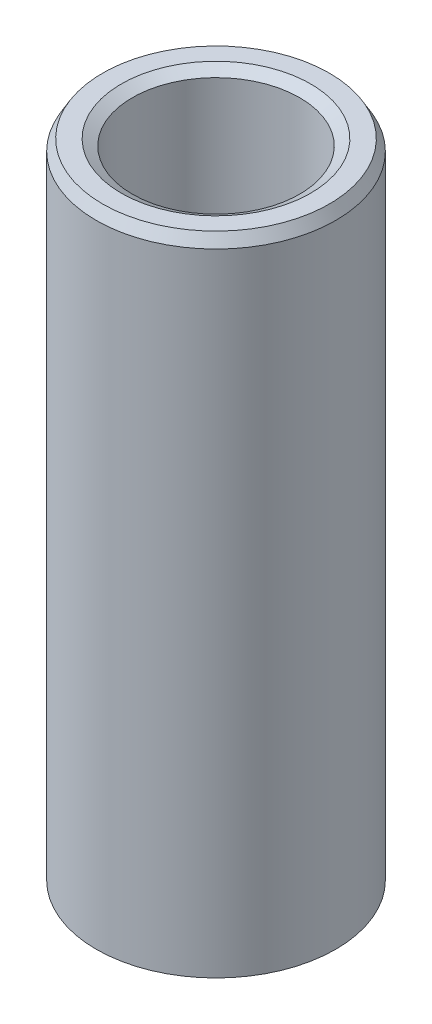
from build123d import *
from OCP.BRepFilletAPI import BRepFilletAPI_MakeChamfer

# Parameters (mm, degrees)
SKETCH1_R           = 40
BOSS_EXTRUDE1_DEPTH = 216.64719836
SKETCH2_R           = 27.940790606
CUT_EXTRUDE1_DEPTH  = 224.910715593
CHAMFER1_SIZE       = 3.686977026
CHAMFER1_SIZE2      = 2.128677179


with BuildPart() as part:
    # Sketch1 → Boss-Extrude1 (new body)
    with BuildSketch(Plane(origin=(0, 0, 0), x_dir=(1, 0, 0), z_dir=(0, 1, 0))):
        Circle(SKETCH1_R)
    extrude(amount=BOSS_EXTRUDE1_DEPTH)

    # Sketch2 → Cut-Extrude1 (cut, through all)
    with BuildSketch(Plane(origin=(0, 0, 0), x_dir=(1, 0, 0), z_dir=(0, 1, 0))):
        Circle(SKETCH2_R)
    extrude(amount=CUT_EXTRUDE1_DEPTH, mode=Mode.SUBTRACT)

    # Chamfer1: one chamfer whose edges measure the first distance from different faces: ONE call of the kernel's chamfer builder (chamfer() names one face for all edges)
    chamfer1_edges_1 = [part.edges().sort_by_distance(p)[0] for p in [
        (-27.940790606, 216.64719836, 0),
    ]]
    chamfer1_side_1 = [part.faces().sort_by_distance(p)[0] for p in [
        (-38.86862915, 216.64719836, 0),
    ]]
    chamfer1_edges_2 = [part.edges().sort_by_distance(p)[0] for p in [
        (-27.940790606, 0, 0),
    ]]
    chamfer1_side_2 = [part.faces().sort_by_distance(p)[0] for p in [
        (-27.940790606, 108.32359918, 0),
    ]]
    chamfer1_edges_3 = [part.edges().sort_by_distance(p)[0] for p in [
        (-40, 0, 0),
    ]]
    chamfer1_side_3 = [part.faces().sort_by_distance(p)[0] for p in [
        (-38.86862915, 0, 0),
    ]]
    chamfer1_edges_4 = [part.edges().sort_by_distance(p)[0] for p in [
        (-40, 216.64719836, 0),
    ]]
    chamfer1_side_4 = [part.faces().sort_by_distance(p)[0] for p in [
        (-40, 108.32359918, 0),
    ]]
    chamfer1 = BRepFilletAPI_MakeChamfer(part.part.solid().wrapped)
    for e in chamfer1_edges_1:
        chamfer1.Add(CHAMFER1_SIZE, CHAMFER1_SIZE2, e.wrapped, chamfer1_side_1[0].wrapped)  # the first distance lies on this face
    for e in chamfer1_edges_2:
        chamfer1.Add(CHAMFER1_SIZE, CHAMFER1_SIZE2, e.wrapped, chamfer1_side_2[0].wrapped)  # the first distance lies on this face
    for e in chamfer1_edges_3:
        chamfer1.Add(CHAMFER1_SIZE, CHAMFER1_SIZE2, e.wrapped, chamfer1_side_3[0].wrapped)  # the first distance lies on this face
    for e in chamfer1_edges_4:
        chamfer1.Add(CHAMFER1_SIZE, CHAMFER1_SIZE2, e.wrapped, chamfer1_side_4[0].wrapped)  # the first distance lies on this face
    add(Compound.cast(chamfer1.Shape()), mode=Mode.REPLACE)


solid = part.part
